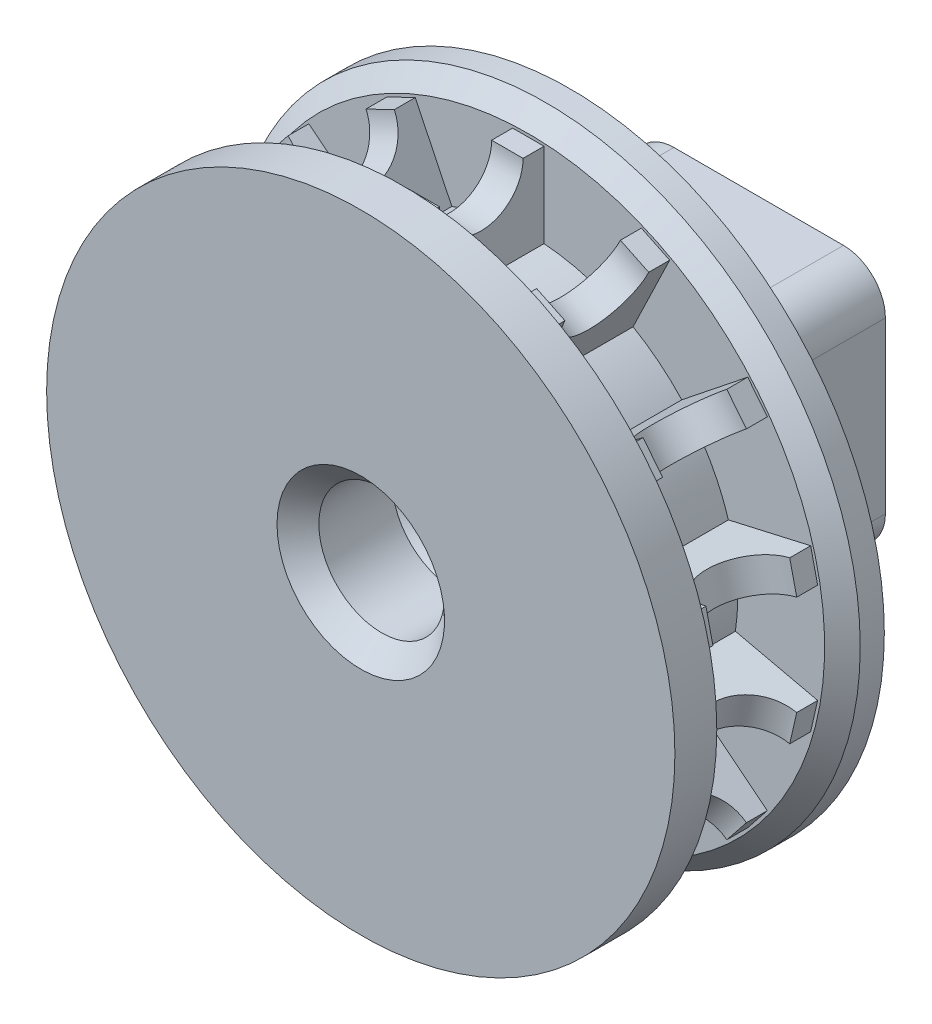
from build123d import *

# Parameters (mm, degrees)
EXTRUDE_1_DEPTH          = 0.75
PATTERN_CIRCULAR_1_COUNT = 14
SKETCH_3_W               = 6.1
SKETCH_3_H               = 6.1
EXTRUDE_2_DEPTH          = 9
FILLET_1_R               = 2
CHAMFER_1_SIZE           = 0.2
CHAMFER_1_SIZE2          = 2.286010461
SKETCH_4_R               = 1.75
CUT_EXTRUDE_1_DEPTH      = 29.478061732
SKETCH_6_R               = 3
CUT_EXTRUDE_2_DEPTH      = 6
CHAMFER_2_SIZE           = 1
CHAMFER_3_SIZE           = 1.5
CHAMFER_4_SIZE           = 0.85


with BuildPart() as part:
    # 草圖1 → 旋轉1 (revolve)
    with BuildSketch(Plane(origin=(0, 0, 0), x_dir=(0, 0, -1), z_dir=(1, 0, 0)), mode=Mode.PRIVATE) as revolve_1_sk:
        Polygon((-5, 0), (5, 0), (5, 15), (3, 15), (3, 10), (-3, 10), (-3, 15), (-5, 15), align=None)
    revolve(revolve_1_sk.sketch.rotate(Axis((0, 0, 5), (0, 0, -1)), 90), axis=Axis((0, 0, 5), (0, 0, -1)))

    # 草圖2 → 填料-伸長1 (add, symmetric)
    with BuildSketch(Plane(origin=(0, 0, 0), x_dir=(0, 0, -1), z_dir=(1, 0, 0))):
        with BuildLine():
            Line((3, 10), (3, 14))
            Line((3, 14), (2, 14))
            ThreePointArc((2, 14), (0, 12), (-2, 14))
            Line((-2, 14), (-3, 14))
            Line((-3, 14), (-3, 10))
            Line((-3, 10), (-3, 8.5))
            Line((-3, 8.5), (3, 8.5))
            Line((3, 8.5), (3, 10))
        make_face()
    extrude_1 = extrude(amount=EXTRUDE_1_DEPTH, both=True)

    # 環狀複製排列1: 填料-伸長1 ×14 about axis
    pattern_circular_1_axis = Axis((0, 0, 0), (0, 0, 1))
    for i in range(1, PATTERN_CIRCULAR_1_COUNT):
        add(extrude_1.rotate(pattern_circular_1_axis, i * 360 / PATTERN_CIRCULAR_1_COUNT))

    # 草圖3 → 填料-伸長2 (add)
    with BuildSketch(Plane(origin=(0, 0, -5), x_dir=(-1, 0, 0), z_dir=(0, 0, -1))):
        with BuildLine():
            Line((-4.05, -6.05), (4.05, -6.05))
            ThreePointArc((4.05, -6.05), (5.464213562, -5.464213562), (6.05, -4.05))
            Line((6.05, -4.05), (6.05, 4.05))
            ThreePointArc((6.05, 4.05), (5.464213562, 5.464213562), (4.05, 6.05))
            Line((4.05, 6.05), (-4.05, 6.05))
            ThreePointArc((-4.05, 6.05), (-5.464213562, 5.464213562), (-6.05, 4.05))
            Line((-6.05, 4.05), (-6.05, -4.05))
            ThreePointArc((-6.05, -4.05), (-5.464213562, -5.464213562), (-4.05, -6.05))
        make_face()
        Rectangle(SKETCH_3_W, SKETCH_3_H, mode=Mode.SUBTRACT)
    extrude(amount=EXTRUDE_2_DEPTH)

    # 圓角1
    fillet_1_edges = [part.edges().sort_by_distance(p)[0] for p in [
        (5.464213562, -5.464213562, -5),
        (0, -6.05, -5),
        (-5.464213562, -5.464213562, -5),
        (-6.05, 0, -5),
        (-5.464213562, 5.464213562, -5),
        (0, 6.05, -5),
        (5.464213562, 5.464213562, -5),
        (6.05, 0, -5),
    ]]
    fillet(fillet_1_edges, radius=FILLET_1_R)

    # 導角1
    chamfer_1_edges = [part.edges().sort_by_distance(p)[0] for p in [
        (-3.05, 0, -14),
        (0, 3.05, -14),
        (3.05, 0, -14),
        (0, -3.05, -14),
    ]]
    chamfer_1_side = [part.faces().sort_by_distance(p)[0] for p in [
        (5.343213562, -5.343213562, -14),
    ]]
    chamfer(chamfer_1_edges, length=CHAMFER_1_SIZE, length2=CHAMFER_1_SIZE2, reference=chamfer_1_side[0])

    # 草圖4 → 除料-伸長1 (cut, through all)
    with BuildSketch(Plane.XY.offset(5)):
        Circle(SKETCH_4_R)
    extrude(amount=-CUT_EXTRUDE_1_DEPTH, mode=Mode.SUBTRACT)

    # 草圖6 → 除料-伸長2 (cut)
    with BuildSketch(Plane.XY.offset(5)):
        Circle(SKETCH_6_R)
    extrude(amount=-CUT_EXTRUDE_2_DEPTH, mode=Mode.SUBTRACT)

    # 導角2
    chamfer_2_edges = [part.edges().sort_by_distance(p)[0] for p in [
        (-3, 0, 5),
    ]]
    chamfer(chamfer_2_edges, length=CHAMFER_2_SIZE)

    # 導角3
    # the kernel refuses this chamfer: 1.5 mm, written as the material it adds along each edge
    with BuildSketch(Plane(origin=(0, 0, -1), x_dir=(1, 0, 0), z_dir=(0, -1, 0))) as chamfer_3_piece_1_section:
        Polygon((3, CHAMFER_3_SIZE), (3 - CHAMFER_3_SIZE, 0), (3, 0), align=None)
    chamfer_3_piece_1 = revolve(axis=Axis((0, 0, -1), (0, 0, 1)), mode=Mode.PRIVATE)
    chamfer_3_piece_1 = chamfer_3_piece_1 - Plane(origin=(0, 0, -0.122651597), x_dir=(1, 0, 0), z_dir=(0, 0, 1)) * Cylinder(1.75, 12, mode=Mode.PRIVATE)
    add(chamfer_3_piece_1)

    # 導角4
    chamfer_4_edges = [part.edges().sort_by_distance(p)[0] for p in [
        (-15, 0, -3),
    ]]
    chamfer(chamfer_4_edges, length=CHAMFER_4_SIZE)


solid = part.part
